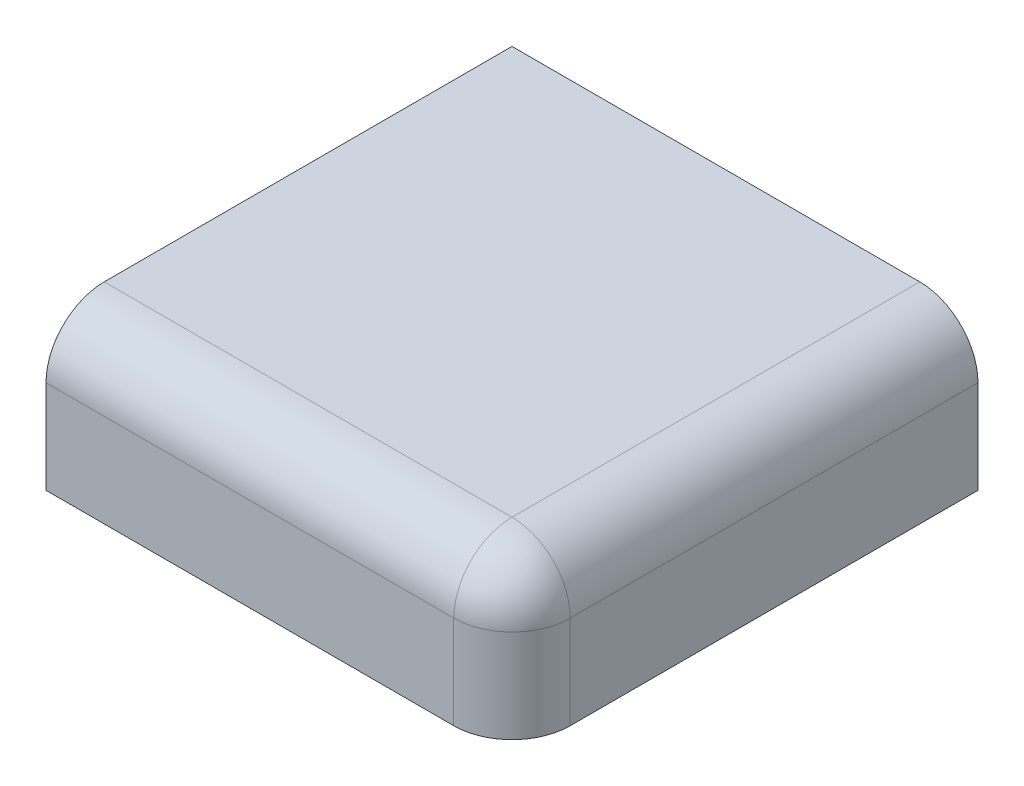
from build123d import *

# Parameters (mm, degrees)
SKETCH_1_W               = 40
SKETCH_1_H               = 40
EXTRUDE_1_DEPTH          = 13
CUT_EXTRUDE_2_DEPTH      = 2.15
PATTERN_CIRCULAR_1_COUNT = 2
PATTERN_CIRCULAR_1_ANGLE = 90
FILLET_2_R               = 5


with BuildPart() as part:
    # Эскиз1 → Бобышка-Вытянуть1 (new body)
    with BuildSketch(Plane(origin=(0, 0, 0), x_dir=(1, 0, 0), z_dir=(0, 1, 0))):
        Rectangle(SKETCH_1_W, SKETCH_1_H)
    extrude(amount=-EXTRUDE_1_DEPTH)

    # Эскиз7 → Вырез-Вытянуть2 (cut)
    with BuildSketch(Plane.ZY.offset(20)):
        with BuildLine():
            Line((2.0375, -3.286148827), (0, -2.109797653))
            Line((0, -2.109797653), (-2.0375, -3.286148827))
            ThreePointArc((-2.0375, -3.286148827), (0, -10.890202347), (2.0375, -3.286148827))
        make_face()
    cut_extrude_2 = extrude(amount=-CUT_EXTRUDE_2_DEPTH, mode=Mode.SUBTRACT)

    # Круговой массив1: Вырез-Вытянуть2 ×2 about axis
    pattern_circular_1_axis = Axis((0, -13, 0), (0, -1, 0))
    for i in range(1, PATTERN_CIRCULAR_1_COUNT):
        add(cut_extrude_2.rotate(pattern_circular_1_axis, i * PATTERN_CIRCULAR_1_ANGLE / (PATTERN_CIRCULAR_1_COUNT - 1)), mode=Mode.SUBTRACT)

    # Скругление2
    fillet_2_edges = [part.edges().sort_by_distance(p)[0] for p in [
        (0, 0, 20),
        (20, 0, 0),
        (20, -6.5, 20),
    ]]
    fillet(fillet_2_edges, radius=FILLET_2_R)


solid = part.part
